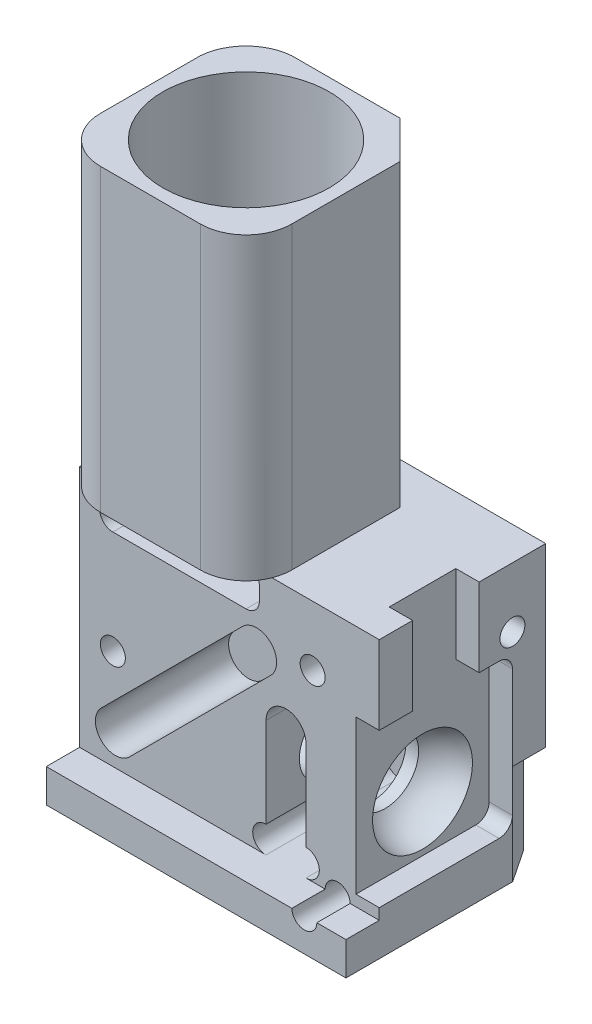
from build123d import *

# Parameters (mm, degrees)
SKETCH1_W                   = 9
SKETCH1_H                   = 6
MAIN_BODY_EXT_DEPTH         = 8.3
EMISSION_PATH_EXT_DEPTH     = 9
SKETCH3_R                   = 1.25
EMISSION_AND_GRIN_CUT_DEPTH = 19.125672401
SKETCH4_R                   = 1
DRUM_LENS_CUT_DEPTH         = 7
SKETCH5_W                   = 9
SKETCH5_H                   = 7.3
FILTERSET_CUT1_DEPTH        = 1
FILTERSET_CUT2_DEPTH        = 4
SKETCH10_R                  = 2.5
EMISSION_LENS_CUT_DEPTH     = 8.5
SKETCH15_R                  = 0.795
MAGNETS_CUT_DEPTH           = 0.9
SCREW_HOLES_CUT_DEPTH       = 19.561788707
SCREW_HOLES_CUT_DEPTH_BACK  = 3
SKETCH18_R                  = 0.375
EXTERNAL_FILLET_1_R         = 1.5
CUT_EXTRUDE8_DEPTH          = 12.545128843
CUT_EXTRUDE8_DEPTH_BACK     = 4
SKETCH28_R                  = 1.5
CUT_EXTRUDE9_DEPTH          = 3
CUT_EXTRUDE10_DEPTH         = 0.7
SKETCH29_R                  = 0.375
CUT_EXTRUDE11_DEPTH         = 2.5
SKETCH32_W                  = 2
SKETCH32_H                  = 2.36
CUT_EXTRUDE14_DEPTH         = 0.7
CUT_EXTRUDE16_DEPTH         = 9
CUT_EXTRUDE17_REACH         = 12.329
SKETCH37_R                  = 2
CUT_EXTRUDE18_START         = -9
CUT_EXTRUDE18_DEPTH         = 9


with BuildPart() as part:
    # Sketch1 → Main Body Ext (new body)
    with BuildSketch(Plane(origin=(0, 0, 0), x_dir=(1, 0, 0), z_dir=(0, 1, 0))):
        Rectangle(SKETCH1_W, SKETCH1_H)
    extrude(amount=MAIN_BODY_EXT_DEPTH)

    # Sketch8 → Emission Path Ext (add)
    with BuildSketch(Plane(origin=(0, 8.3, 0), x_dir=(1, 0, 0), z_dir=(0, 1, 0))):
        Polygon((0.25, 3), (1.5, 1.75), (1.5, -3), (-4.5, -3), (-4.5, 3), align=None)
    extrude(amount=EMISSION_PATH_EXT_DEPTH)

    # Sketch3 → Emission and Grin Cut (cut, through all)
    with BuildSketch(Plane.XZ):
        with Locations(Location((-1.5, 0, 0), (0, 0, 270))):
            Circle(SKETCH3_R)
    extrude(amount=-EMISSION_AND_GRIN_CUT_DEPTH, mode=Mode.SUBTRACT)

    # Sketch4 → Drum Lens Cut (cut)
    with BuildSketch(Plane(origin=(4.5, 0, 0), x_dir=(0, 0, -1), z_dir=(1, 0, 0))):
        with Locations((0, 3)):
            Circle(SKETCH4_R)
    extrude(amount=-DRUM_LENS_CUT_DEPTH, mode=Mode.SUBTRACT)

    # Sketch5 → FilterSet Cut1 (cut)
    with BuildSketch(Plane.XY.offset(3)):
        with Locations((0, 4.65)):
            Rectangle(SKETCH5_W, SKETCH5_H)
    extrude(amount=-FILTERSET_CUT1_DEPTH, mode=Mode.SUBTRACT)

    # Sketch6 → FilterSet Cut2 (cut)
    with BuildSketch(Plane.XY.offset(2)):
        with BuildLine():
            Line((2.3, 4.5), (2.3, 1.8))
            ThreePointArc((2.3, 1.8), (2.7, 1.4), (2.3, 1))
            Line((2.3, 1), (1.1, 1))
            ThreePointArc((1.1, 1), (0.7, 1.4), (1.1, 1.8))
            Line((1.1, 1.8), (1.1, 4.5))
            ThreePointArc((1.1, 4.5), (1.7, 5.1), (2.3, 4.5))
        make_face()
        with BuildLine():
            Line((-3.9, 7.9), (-3.9, 7.5))
            ThreePointArc((-3.9, 7.5), (-3.782842712, 7.217157288), (-3.5, 7.1))
            Line((-3.5, 7.1), (0.5, 7.1))
            ThreePointArc((0.5, 7.1), (0.782842712, 7.217157288), (0.9, 7.5))
            Line((0.9, 7.5), (0.9, 7.9))
            ThreePointArc((0.9, 7.9), (0.782842712, 8.182842712), (0.5, 8.3))
            Line((0.5, 8.3), (-3.5, 8.3))
            ThreePointArc((-3.5, 8.3), (-3.782842712, 8.182842712), (-3.9, 7.9))
        make_face()
        with BuildLine():
            Line((0.39411255, 6.591168825), (-3.848528137, 2.348528137))
            ThreePointArc((-3.848528137, 2.348528137), (-3.848528137, 1.5), (-3, 1.5))
            Line((-3, 1.5), (1.242640687, 5.742640687))
            ThreePointArc((1.242640687, 5.742640687), (1.242640687, 6.591168825), (0.39411255, 6.591168825))
        make_face()
    extrude(amount=-FILTERSET_CUT2_DEPTH, mode=Mode.SUBTRACT)

    # Sketch10 → Emission Lens Cut (cut)
    with BuildSketch(Plane(origin=(0, 17.3, 0), x_dir=(1, 0, 0), z_dir=(0, 1, 0))):
        with Locations(Location((-1.5, 0, 0), (0, 0, 270))):
            Circle(SKETCH10_R)
    extrude(amount=-EMISSION_LENS_CUT_DEPTH, mode=Mode.SUBTRACT)

    # Sketch15 → Magnets Cut (cut)
    with BuildSketch(Plane.XZ):
        with Locations(Location((-3.25, -1.875, 0), (0, 0, 270))):
            Circle(SKETCH15_R)
        with Locations(Location((-3.25, 1.875, 0), (0, 0, 270))):
            Circle(SKETCH15_R)
        with Locations(Location((1.5, 0, 0), (0, 0, 270))):
            Circle(SKETCH15_R)
    extrude(amount=-MAGNETS_CUT_DEPTH, mode=Mode.SUBTRACT)

    # Sketch18 → Screw Holes Cut (cut, two sides: drawn at the far end of the back side and taken through both)
    with BuildSketch(Plane.XY.offset(2).offset(-SCREW_HOLES_CUT_DEPTH_BACK)):
        with Locations(Location((-3.5, 4, 0), (0, 0, 180))):
            Circle(SKETCH18_R)
        with Locations(Location((2.5, 6.5, 0), (0, 0, 180))):
            Circle(SKETCH18_R)
        with Locations((3.25, 1)):
            Circle(SKETCH18_R)
    extrude(amount=SCREW_HOLES_CUT_DEPTH + SCREW_HOLES_CUT_DEPTH_BACK, mode=Mode.SUBTRACT)

    # External Fillet 1
    # the kernel refuses this fillet: 1.5 mm, written as the material it takes off along each edge
    with BuildSketch(Plane(origin=(-4.5, -3.75, -3), x_dir=(1, 0, 0), z_dir=(0, 1, 0))) as external_fillet_1_piece_1:
        with BuildLine():
            CenterArc((EXTERNAL_FILLET_1_R, -EXTERNAL_FILLET_1_R), EXTERNAL_FILLET_1_R, 90, 90)
            Line((0, -EXTERNAL_FILLET_1_R), (0, 0))
            Line((0, 0), (EXTERNAL_FILLET_1_R, 0))
        make_face()
    extrude(amount=24.8, mode=Mode.SUBTRACT)
    with BuildSketch(Plane(origin=(1.5, 8.3, 3), x_dir=(0, 0, -1), z_dir=(0, 1, 0))) as external_fillet_1_piece_2:
        with BuildLine():
            CenterArc((EXTERNAL_FILLET_1_R, EXTERNAL_FILLET_1_R), EXTERNAL_FILLET_1_R, 180, 90)
            Line((0, EXTERNAL_FILLET_1_R), (0, 0))
            Line((0, 0), (EXTERNAL_FILLET_1_R, 0))
        make_face()
    extrude(amount=12.75, mode=Mode.SUBTRACT)

    # Sketch28 → Cut-Extrude8 (cut, two sides: drawn at the far end of the back side and taken through both)
    with BuildSketch(Plane(origin=(0, 7.1, 0), x_dir=(1, 0, 0), z_dir=(0, 1, 0)).offset(-CUT_EXTRUDE8_DEPTH_BACK)):
        with Locations(Location((-1.5, 0, 0), (0, 0, 180))):
            Circle(SKETCH28_R)
    extrude(amount=CUT_EXTRUDE8_DEPTH + CUT_EXTRUDE8_DEPTH_BACK, mode=Mode.SUBTRACT)

    # Sketch14 → Cut-Extrude9 (cut)
    with BuildSketch(Plane.XZ):
        Polygon((4.5, -3), (4.5, -2.006698359), (3.837798906, -3), align=None)
    extrude(amount=-CUT_EXTRUDE9_DEPTH, mode=Mode.SUBTRACT)

    # Sketch12 → Cut-Extrude10 (cut)
    with BuildSketch(Plane(origin=(4.5, 0, 0), x_dir=(0, 0, -1), z_dir=(1, 0, 0))):
        with BuildLine():
            Line((1.6, 5.94), (-1.6, 5.94))
            Line((-1.6, 5.94), (-2, 5.94))
            Line((-2, 5.94), (-2, 1.33))
            Line((-2, 1.33), (1.6, 1.33))
            ThreePointArc((1.6, 1.33), (1.882842712, 1.447157288), (2, 1.73))
            Line((2, 1.73), (2, 5.54))
            ThreePointArc((2, 5.54), (1.882842712, 5.822842712), (1.6, 5.94))
        make_face()
    extrude(amount=-CUT_EXTRUDE10_DEPTH, mode=Mode.SUBTRACT)

    # Sketch29 → Cut-Extrude11 (cut)
    with BuildSketch(Plane(origin=(4.5, 0, 0), x_dir=(0, 0, -1), z_dir=(1, 0, 0))):
        with Locations((2, 6.5)):
            Circle(SKETCH29_R)
    extrude(amount=-CUT_EXTRUDE11_DEPTH, mode=Mode.SUBTRACT)

    # Sketch32 → Cut-Extrude14 (cut)
    with BuildSketch(Plane(origin=(4.5, 0, 0), x_dir=(0, 0, -1), z_dir=(1, 0, 0))):
        with Locations((0, 7.12)):
            Rectangle(SKETCH32_W, SKETCH32_H)
    extrude(amount=-CUT_EXTRUDE14_DEPTH, mode=Mode.SUBTRACT)

    # Sketch33 → Cut-Revolve1 (revolve, cut)
    with BuildSketch(Plane.XY, mode=Mode.PRIVATE) as cut_revolve1_sk:
        with BuildLine():
            Line((3.8, 3), (2.3, 3))
            ThreePointArc((2.3, 3), (2.739339828, 4.060660172), (3.8, 4.5))
            Line((3.8, 4.5), (3.8, 3))
        make_face()
    revolve(cut_revolve1_sk.sketch.rotate(Axis((3.8, 3, 0), (-1, 0, 0)), 90), axis=Axis((3.8, 3, 0), (-1, 0, 0)), mode=Mode.SUBTRACT)

    # Sketch36 → Cut-Extrude16 (cut)
    with BuildSketch(Plane(origin=(0, 17.3, 0), x_dir=(1, 0, 0), z_dir=(0, 1, 0))):
        with BuildLine():
            Line((-4.5, -1.5), (-4.5, -3))
            Line((-4.5, -3), (-3, -3))
            ThreePointArc((-3, -3), (-4.060660172, -2.560660172), (-4.5, -1.5))
        make_face()
    extrude(amount=-CUT_EXTRUDE16_DEPTH, mode=Mode.SUBTRACT)

    # Sketch37 → Cut-Extrude17 (cut, up to next)
    with BuildSketch(Plane(origin=(0, 8.8, 0), x_dir=(1, 0, 0), z_dir=(0, 1, 0)), mode=Mode.PRIVATE) as cut_extrude17_sk1:
        with Locations(Location((-1.5, 0, 0), (0, 0, 180))):
            Circle(SKETCH37_R)
    cut_extrude17_tool1 = extrude(cut_extrude17_sk1.sketch, amount=-CUT_EXTRUDE17_REACH, mode=Mode.PRIVATE) & part.part
    add(cut_extrude17_tool1.solids().sort_by_distance((-1.5, 8.8, 0))[0], mode=Mode.SUBTRACT)

    # Sketch38 → Cut-Extrude18 (cut)
    with BuildSketch(Plane(origin=(0, 17.3, 0), x_dir=(1, 0, 0), z_dir=(0, 1, 0)).offset(CUT_EXTRUDE18_START)):
        with BuildLine():
            Line((-3, 3), (0.25, 3))
            Line((0.25, 3), (1.5, 1.75))
            Line((1.5, 1.75), (1.5, -1.5))
            ThreePointArc((1.5, -1.5), (1.060660172, -2.560660172), (0, -3))
            Line((0, -3), (-3, -3))
            ThreePointArc((-3, -3), (-4.060660172, -2.560660172), (-4.5, -1.5))
            Line((-4.5, -1.5), (-4.5, 1.5))
            ThreePointArc((-4.5, 1.5), (-4.060660172, 2.560660172), (-3, 3))
        make_face()
        with BuildLine():
            Line((-4.375, -1.5), (-4.375, 1.5))
            ThreePointArc((-4.375, 1.5), (-3.940482173, 2.440482173), (-3, 2.875))
            Line((-3, 2.875), (0.25, 2.875))
            Line((0.25, 2.875), (1.375, 1.75))
            Line((1.375, 1.75), (1.375, -1.5))
            ThreePointArc((1.375, -1.5), (0.972271824, -2.472271824), (0, -2.875))
            Line((0, -2.875), (-3, -2.875))
            ThreePointArc((-3, -2.875), (-3.972271824, -2.472271824), (-4.375, -1.5))
        make_face(mode=Mode.SUBTRACT)
    extrude(amount=CUT_EXTRUDE18_DEPTH, mode=Mode.SUBTRACT)


solid = part.part
